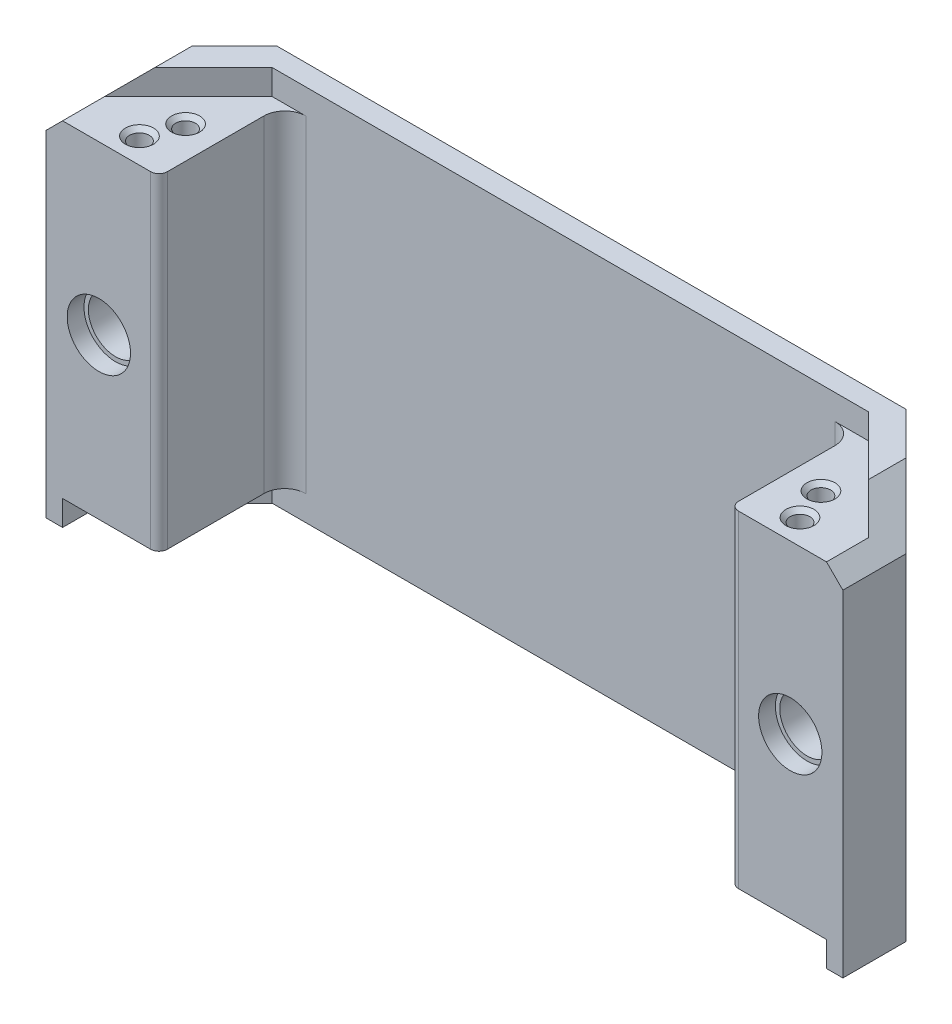
from build123d import *

# Parameters (mm, degrees)
SKETCH1_W                      = 190
SKETCH1_H                      = 90
BOSS_EXTRUDE1_DEPTH            = 5
SKETCH2_W                      = 3.9
SKETCH2_H                      = 90
BOSS_EXTRUDE2_DEPTH            = 30
SKETCH3_W                      = 34
SKETCH3_H                      = 5
SKETCH3_W_2                    = 47
BOSS_EXTRUDE3_DEPTH            = 90
SKETCH4_W                      = 182.2
SKETCH4_H                      = 6
CUT_EXTRUDE1_DEPTH             = 5
CHAMFER6_SIZE                  = 20
BOSS_EXTRUDE4_DEPTH            = 78
FILLET5_R                      = 2
SKETCH9_R                      = 6.5
CUT_EXTRUDE4_DEPTH             = 10
SKETCH10_R                     = 7.55
CUT_EXTRUDE5_DEPTH             = 4
SKETCH15_R                     = 2.35
CUT_EXTRUDE7_DEPTH             = 8
CHAMFER7_SIZE                  = 1
SKETCH17_R                     = 6.1
CUT_EXTRUDE8_DEPTH             = 3.2
FILLET7_R                      = 0.2
CHAMFER8_SIZE                  = 9.9
CUT_EXTRUDE9_REACH             = 164.433
SKETCH18_W                     = 5
SKETCH18_H                     = 78
CUT_EXTRUDE9_DIRECTION_2_REACH = 164.433
BOSS_EXTRUDE5_DEPTH            = 78
FILLET8_R                      = 5


with BuildPart() as part:
    # Sketch1 → Boss-Extrude1 (new body)
    with BuildSketch(Plane.XY):
        Rectangle(SKETCH1_W, SKETCH1_H)
    extrude(amount=BOSS_EXTRUDE1_DEPTH)

    # Sketch2 → Boss-Extrude2 (add)
    with BuildSketch(Plane.XY.offset(5)):
        with Locations((-93.05, 0)):
            Rectangle(SKETCH2_W, SKETCH2_H)
        with Locations((93.05, 0)):
            Rectangle(SKETCH2_W, SKETCH2_H)
    extrude(amount=BOSS_EXTRUDE2_DEPTH)

    # Sketch3 → Boss-Extrude3 (add)
    with BuildSketch(Plane(origin=(0, 45, 0), x_dir=(1, 0, 0), z_dir=(0, 1, 0))):
        with Locations((-74.1, -16.5)):
            Rectangle(SKETCH3_W, SKETCH3_H)
        with Locations((67.6, -16.5)):
            Rectangle(SKETCH3_W_2, SKETCH3_H)
    extrude(amount=-BOSS_EXTRUDE3_DEPTH)

    # Sketch4 → Cut-Extrude1 (cut)
    with BuildSketch(Plane.XY.offset(19)):
        with Locations((0, 42)):
            Rectangle(SKETCH4_W, SKETCH4_H)
        with Locations((0, -42)):
            Rectangle(SKETCH4_W, SKETCH4_H)
    extrude(amount=-CUT_EXTRUDE1_DEPTH, mode=Mode.SUBTRACT)

    # Chamfer6
    # the kernel refuses this chamfer: 20 mm, written as the material it adds along each edge
    with BuildSketch(Plane(origin=(-91.1, 45, 5), x_dir=(0.9996219169112968, 0, -0.02749587661058636), z_dir=(0, -1, 0))) as chamfer6_piece_1:
        Polygon((CHAMFER6_SIZE * 0.999621916911, CHAMFER6_SIZE * 0.0274958766106), (-CHAMFER6_SIZE * 0.0274958766106, CHAMFER6_SIZE * 0.999621916911), (0, 0), align=None)
    extrude(amount=90)
    with BuildSketch(Plane(origin=(91.1, -45, 5), x_dir=(0.027495876610586317, 0, 0.9996219169112968), z_dir=(0, 1, 0))) as chamfer6_piece_2:
        Polygon((CHAMFER6_SIZE * 0.999621916911, -CHAMFER6_SIZE * 0.0274958766106), (-CHAMFER6_SIZE * 0.0274958766106, -CHAMFER6_SIZE * 0.999621916911), (0, 0), align=None)
    extrude(amount=90)
    # the kernel refuses this chamfer: 20 mm, written as the material it takes off along each edge
    with BuildSketch(Plane(origin=(-95, -96.433659759, 0), x_dir=(0.9996219169112968, 0, -0.027495876610586372), z_dir=(0, 1, 0)), Plane(origin=(95, 96.433659759, 0), x_dir=(-0.9996219169112968, 0, -0.027495876610586372), z_dir=(0, -1, 0))) as chamfer6_2_piece_1:
        Polygon((CHAMFER6_SIZE * 0.999621916911, -CHAMFER6_SIZE * 0.0274958766106), (-CHAMFER6_SIZE * 0.0274958766106, -CHAMFER6_SIZE * 0.999621916911), (0, 0), align=None)
    extrude(amount=192.867319519, mode=Mode.SUBTRACT)

    # Sketch7 → Boss-Extrude4 (add)
    with BuildSketch(Plane(origin=(0, 39, 0), x_dir=(1, 0, 0), z_dir=(0, 1, 0))):
        Polygon((-85.1, -19), (-91.1, -25), (-91.1, -35), (-68.1, -35), (-68.1, -19), align=None)
        Polygon((68.1, -35), (68.1, -19), (85.1, -19), (91.1, -25), (91.1, -35), align=None)
    extrude(amount=-BOSS_EXTRUDE4_DEPTH)

    # Fillet5
    fillet5_edges = [part.edges().sort_by_distance(p)[0] for p in [
        (-68.1, 0, 35),
        (68.1, 0, 35),
    ]]
    fillet(fillet5_edges, radius=FILLET5_R)

    # Sketch9 → Cut-Extrude4 (cut)
    with BuildSketch(Plane.XY.offset(35)):
        with Locations((-82.45, -0.90743758)):
            Circle(SKETCH9_R)
        with Locations(Location((82.45, -0.90743758, 0), (0, 0, 180))):
            Circle(SKETCH9_R)
    extrude(amount=-CUT_EXTRUDE4_DEPTH, mode=Mode.SUBTRACT)

    # Sketch10 → Cut-Extrude5 (cut)
    with BuildSketch(Plane.XY.offset(35)):
        with Locations((-82.45, -0.90743758)):
            Circle(SKETCH10_R)
        with Locations((82.45, -0.90743758)):
            Circle(SKETCH10_R)
    extrude(amount=-CUT_EXTRUDE5_DEPTH, mode=Mode.SUBTRACT)

    # Sketch15 → Cut-Extrude7 (cut)
    with BuildSketch(Plane(origin=(0, 39, 0), x_dir=(1, 0, 0), z_dir=(0, 1, 0))):
        with Locations(Location((75.766666667, -21, 0), (0, 0, 270))):
            Circle(SKETCH15_R)
        with Locations(Location((-75.766666667, -21, 0), (0, 0, 90))):
            Circle(SKETCH15_R)
        with Locations(Location((78.766666667, -29, 0), (0, 0, 270))):
            Circle(SKETCH15_R)
        with Locations(Location((-78.766666667, -29, 0), (0, 0, 90))):
            Circle(SKETCH15_R)
    extrude(amount=-CUT_EXTRUDE7_DEPTH, mode=Mode.SUBTRACT)

    # Chamfer7
    chamfer7_edges = [part.edges().sort_by_distance(p)[0] for p in [
        (-75.766666667, 39, 23.35),
        (78.766666667, 39, 26.65),
        (-78.766666667, 39, 31.35),
        (75.766666667, 39, 18.65),
    ]]
    chamfer(chamfer7_edges, length=CHAMFER7_SIZE)

    # Sketch17 → Cut-Extrude8 (cut)
    with BuildSketch(Plane.XZ.offset(39)):
        with Locations((79.6, 27)):
            Circle(SKETCH17_R)
        with Locations(Location((-79.6, 27, 0), (0, 0, 180))):
            Circle(SKETCH17_R)
    extrude(amount=-CUT_EXTRUDE8_DEPTH, mode=Mode.SUBTRACT)

    # Fillet7
    fillet7_edges = [part.edges().sort_by_distance(p)[0] for p in [
        (73.5, -39, 27),
        (-73.5, -39, 27),
    ]]
    fillet(fillet7_edges, radius=FILLET7_R)

    # Chamfer8
    # the kernel refuses this chamfer: 9.9 mm, written as the material it takes off along each edge
    with BuildSketch(Plane(origin=(-95, 45, -5.459661581), x_dir=(0.9996219169112968, 0.027495876610586265, 0), z_dir=(0, 0, 1)), Plane(origin=(95, 45, 60.459661581), x_dir=(-0.9996219169112968, 0.02749587661058615, 0), z_dir=(0, 0, -1))) as chamfer8_piece_1:
        Polygon((CHAMFER8_SIZE * 0.999621916911, -CHAMFER8_SIZE * 0.0274958766106), (-CHAMFER8_SIZE * 0.0274958766106, -CHAMFER8_SIZE * 0.999621916911), (0, 0), align=None)
    extrude(amount=65.919323162, mode=Mode.SUBTRACT)

    # Cut-Extrude9: up to this face of the body (flat: up to its plane)
    cut_extrude9_end = Plane(part.part.faces().sort_by_distance((-68.1, 0, 26))[0])
    # Sketch18 → Cut-Extrude9 (cut, up to the picked face)
    with BuildSketch(Plane(origin=(-57.1, 0, 0), x_dir=(0, 0, -1), z_dir=(1, 0, 0)), mode=Mode.PRIVATE) as cut_extrude9_sk1:
        with Locations((-16.5, 0)):
            Rectangle(SKETCH18_W, SKETCH18_H)
    cut_extrude9_tool1 = split(extrude(cut_extrude9_sk1.sketch, amount=-CUT_EXTRUDE9_REACH, mode=Mode.PRIVATE), bisect_by=cut_extrude9_end, keep=Keep.BOTH, mode=Mode.PRIVATE)
    add(cut_extrude9_tool1.solids().sort_by(Axis((-57.1, 0, 16.5), (-1, 0, 0)))[0], mode=Mode.SUBTRACT)

    # Cut-Extrude9 direction 2: up to this face of the body (flat: up to its plane)
    cut_extrude9_direction_2_end = Plane(part.part.faces().sort_by_distance((68.1, 0, 26))[0])
    # Sketch18 → Cut-Extrude9 direction 2 (cut, up to the picked face)
    with BuildSketch(Plane(origin=(-57.1, 0, 0), x_dir=(0, 0, -1), z_dir=(1, 0, 0)), mode=Mode.PRIVATE) as cut_extrude9_direction_2_sk1:
        with Locations((-16.5, 0)):
            Rectangle(SKETCH18_W, SKETCH18_H)
    cut_extrude9_direction_2_tool1 = split(extrude(cut_extrude9_direction_2_sk1.sketch, amount=CUT_EXTRUDE9_DIRECTION_2_REACH, mode=Mode.PRIVATE), bisect_by=cut_extrude9_direction_2_end, keep=Keep.BOTH, mode=Mode.PRIVATE)
    add(cut_extrude9_direction_2_tool1.solids().sort_by(Axis((-57.1, 0, 16.5), (1, 0, 0)))[0], mode=Mode.SUBTRACT)

    # Sketch20 → Boss-Extrude5 (add)
    with BuildSketch(Plane(origin=(0, 39, 0), x_dir=(1, 0, 0), z_dir=(0, 1, 0))):
        Polygon((-68.1, -14), (-68.1, -5), (-71.1, -5), (-80.1, -14), align=None)
        Polygon((71.1, -5), (80.1, -14), (68.1, -14), (68.1, -5), align=None)
    extrude(amount=-BOSS_EXTRUDE5_DEPTH)

    # Fillet8
    fillet8_edges = [part.edges().sort_by_distance(p)[0] for p in [
        (-68.1, 0, 5),
        (68.1, 0, 5),
    ]]
    fillet(fillet8_edges, radius=FILLET8_R)


solid = part.part
